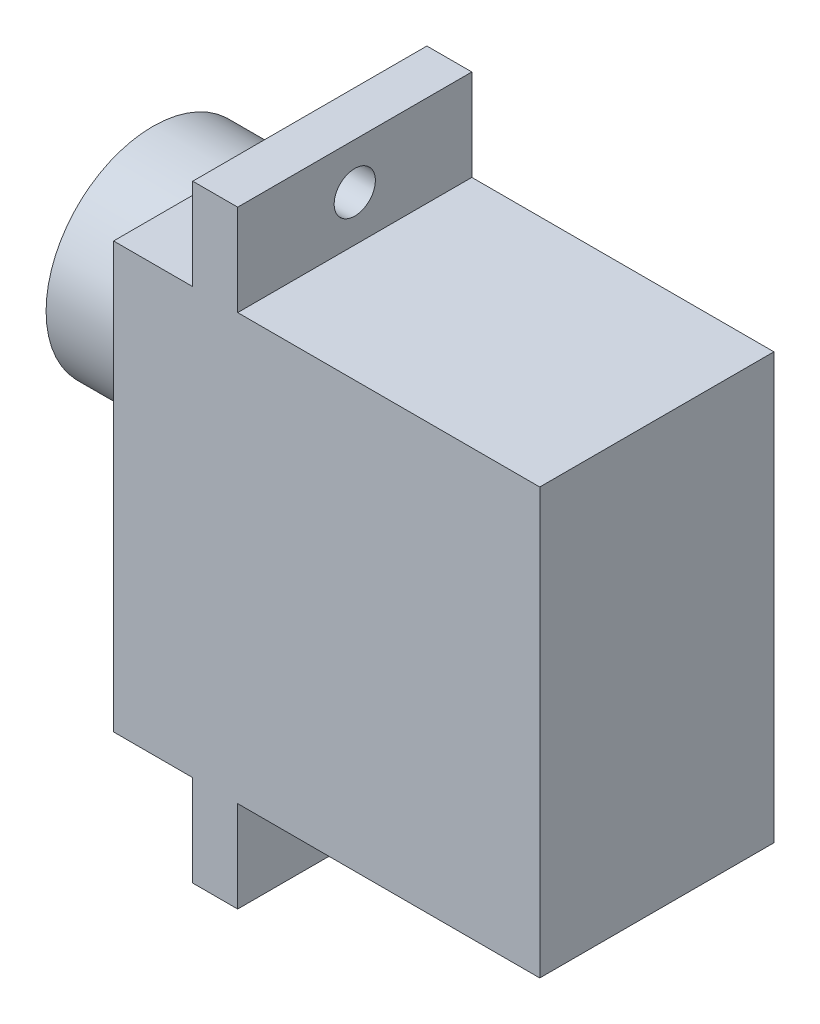
from build123d import *

# Parameters (mm, degrees)
SKETCH1_W           = 22.75
SKETCH1_H           = 22.7
BOSS_EXTRUDE1_DEPTH = 12.5
SKETCH2_R           = 5.7
BOSS_EXTRUDE2_DEPTH = 4.25
SKETCH3_R           = 2.3
CUT_EXTRUDE1_DEPTH  = 2
SKETCH4_W           = 12.5
SKETCH4_H           = 4.875
BOSS_EXTRUDE3_DEPTH = 2.4
SKETCH5_R           = 1.1
CUT_EXTRUDE2_DEPTH  = 2.4


with BuildPart() as part:
    # Sketch1 → Boss-Extrude1 (new body)
    with BuildSketch(Plane.XY):
        Rectangle(SKETCH1_W, SKETCH1_H)
    extrude(amount=BOSS_EXTRUDE1_DEPTH)

    # Sketch2 → Boss-Extrude2 (add)
    with BuildSketch(Plane.ZY.offset(11.375)):
        with Locations((6.152972547, 5.65)):
            Circle(SKETCH2_R)
    extrude(amount=BOSS_EXTRUDE2_DEPTH)

    # Sketch3 → Cut-Extrude1 (cut)
    with BuildSketch(Plane.ZY.offset(15.625)):
        with Locations((6.152972547, 5.65)):
            Circle(SKETCH3_R)
    extrude(amount=-CUT_EXTRUDE1_DEPTH, mode=Mode.SUBTRACT)

    # Sketch4 → Boss-Extrude3 (add)
    with BuildSketch(Plane(origin=(-7.15, 0, 0), x_dir=(0, 0, -1), z_dir=(1, 0, 0))):
        with Locations((-6.25, 13.7875)):
            Rectangle(SKETCH4_W, SKETCH4_H)
        with Locations((-6.25, -13.7875)):
            Rectangle(SKETCH4_W, SKETCH4_H)
    extrude(amount=BOSS_EXTRUDE3_DEPTH)

    # Sketch5 → Cut-Extrude2 (cut)
    with BuildSketch(Plane.ZY.offset(7.15)):
        with Locations((6.25, 13.7875)):
            Circle(SKETCH5_R)
        with Locations((6.25, -13.7875)):
            Circle(SKETCH5_R)
    extrude(amount=-CUT_EXTRUDE2_DEPTH, mode=Mode.SUBTRACT)


solid = part.part
